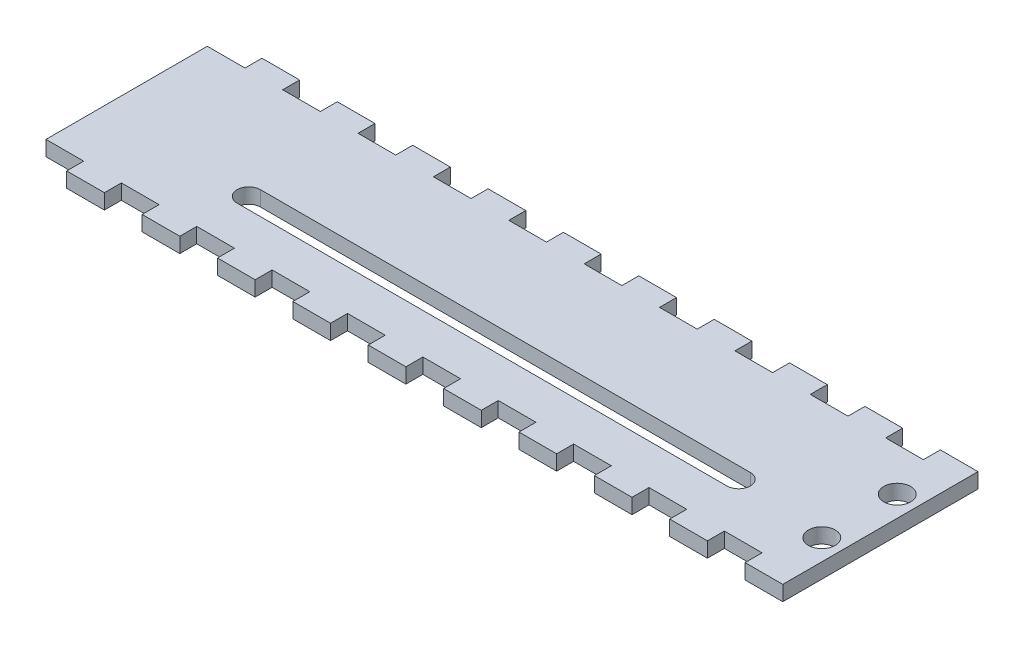
from build123d import *

# Parameters (mm, degrees)
SKETCH1_R           = 1.78
BOSS_EXTRUDE1_DEPTH = 2


with BuildPart() as part:
    # Sketch1 → Boss-Extrude1 (new body)
    with BuildSketch(Plane(origin=(0, 0, 0), x_dir=(1, 0, 0), z_dir=(0, 1, 0))):
        Polygon((0, 21.4), (0, 0), (5, 0), (5, -2.25), (10, -2.25), (10, 0), (15, 0), (15, -2.25), (20, -2.25), (20, 0), (25, 0), (25, -2.25), (30, -2.25), (30, 0), (35, 0), (35, -2.25), (40, -2.25), (40, 0), (45, 0), (45, -2.25), (50, -2.25), (50, 0), (55, 0), (55, -2.25), (60, -2.25), (60, 0), (65, 0), (65, -2.25), (70, -2.25), (70, 0), (75, 0), (75, -2.25), (80, -2.25), (80, 0), (85, 0), (85, -2.25), (90, -2.25), (90, 0), (95, 0), (95, -2.25), (100, -2.25), (100, 23.65), (95, 23.65), (95, 21.4), (90, 21.4), (90, 23.65), (85, 23.65), (85, 21.4), (80, 21.4), (80, 23.65), (75, 23.65), (75, 21.4), (70, 21.4), (70, 23.65), (65, 23.65), (65, 21.4), (60, 21.4), (60, 23.65), (55, 23.65), (55, 21.4), (50, 21.4), (50, 23.65), (45, 23.65), (45, 21.4), (40, 21.4), (40, 23.65), (35, 23.65), (35, 21.4), (30, 21.4), (30, 23.65), (25, 23.65), (25, 21.4), (20, 21.4), (20, 23.65), (15, 23.65), (15, 21.4), (10, 21.4), (10, 23.65), (5, 23.65), (5, 21.4), align=None)
        with BuildLine():
            Line((85, 5.35), (20, 5.35))
            ThreePointArc((20, 5.35), (18.45, 6.9), (20, 8.45))
            Line((20, 8.45), (85, 8.45))
            ThreePointArc((85, 8.45), (86.55, 6.9), (85, 5.35))
        make_face(mode=Mode.SUBTRACT)
        with Locations((97.23, 5.7)):
            Circle(SKETCH1_R, mode=Mode.SUBTRACT)
        with Locations((97.23, 15.7)):
            Circle(SKETCH1_R, mode=Mode.SUBTRACT)
    extrude(amount=BOSS_EXTRUDE1_DEPTH)


solid = part.part
